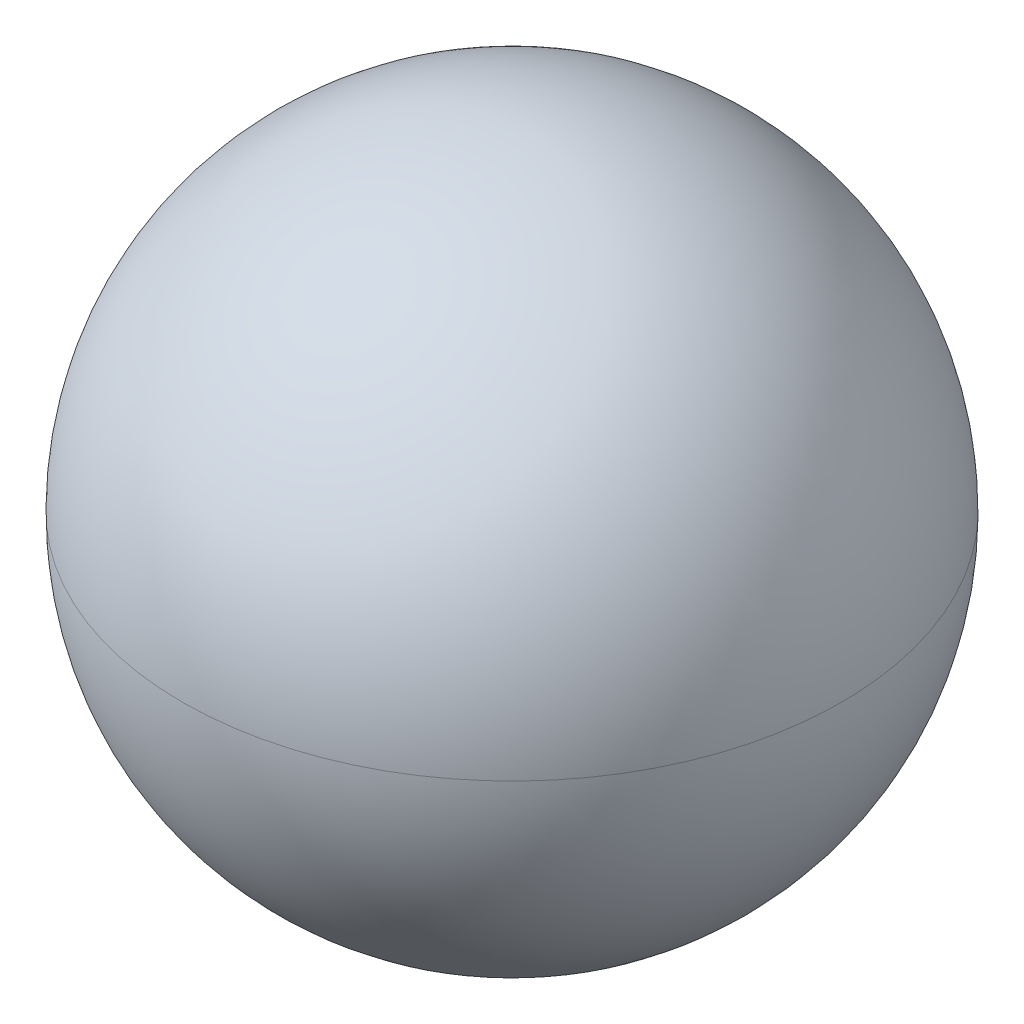
from build123d import *

# Parameters (mm, degrees)
SKETCH1_R           = 274.32
BOSS_EXTRUDE1_DEPTH = 548.64
FILLET1_R           = 274.32
SHELL2_T            = 3.175


with BuildPart() as part:
    # Sketch1 → Boss-Extrude1 (new body)
    with BuildSketch(Plane(origin=(0, 0, 0), x_dir=(1, 0, 0), z_dir=(0, 1, 0))):
        with Locations(Location((0, 0, 0), (0, 0, 270))):
            Circle(SKETCH1_R)
    extrude(amount=BOSS_EXTRUDE1_DEPTH)

    # Fillet1
    fillet1_edges = [part.edges().sort_by_distance(p)[0] for p in [
        (0, 0, -274.32),
        (0, 548.64, -274.32),
    ]]
    fillet(fillet1_edges, radius=FILLET1_R - 0.0001)  # a hair under: the kernel refuses the full size

    # Shell2 (no face opened: a closed hollow body)
    add(offset(amount=-SHELL2_T, mode=Mode.PRIVATE), mode=Mode.SUBTRACT)


solid = part.part
